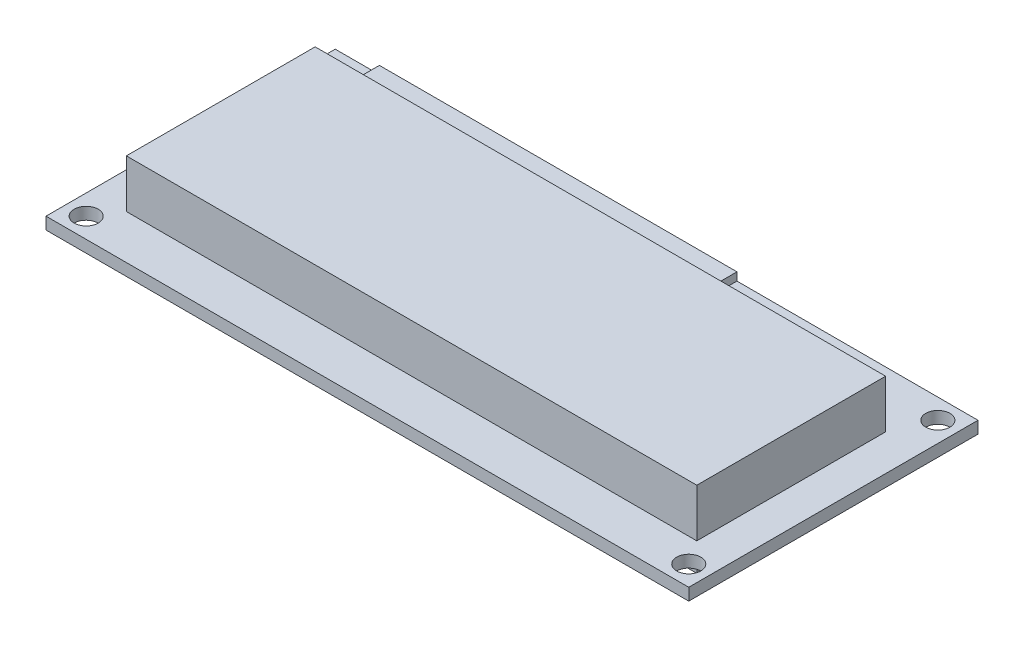
from build123d import *

# Parameters (mm, degrees)
SKETCH_1_W            = 80
SKETCH_1_H            = 36
SKETCH_1_R            = 1.5
EXTRUDE_1_DEPTH       = 1.5
EXTRUDE_START         = 7
EXTRUDE_2_OUTLINE_W   = 71
EXTRUDE_2_OUTLINE_H   = 6
EXTRUDE_2_OUTLINE_H_2 = 2
EXTRUDE_2_DEPTH       = 23.5
EXTRUDE_2_2_OUTLINE_W = 44.5
EXTRUDE_2_2_OUTLINE_H = 1
EXTRUDE_2_2_DEPTH     = 3.5


# Read off the part's stored shape, not the designer's step: Бобышка-Вытянуть2
with BuildPart() as part:
    # Эскиз1 (on Top Plane) → Бобышка-Вытянуть1 (new body)
    with BuildSketch(Plane(origin=(0, 0, 0), x_dir=(1, 0, 0), z_dir=(0, 1, 0))):
        with Locations((40, -18)):
            Rectangle(SKETCH_1_W, SKETCH_1_H)
        with Locations(Location((2.5, -2.5, 0), (0, 0, 270))):
            Circle(SKETCH_1_R, mode=Mode.SUBTRACT)
        with Locations(Location((77.5, -2.5, 0), (0, 0, 90))):
            Circle(SKETCH_1_R, mode=Mode.SUBTRACT)
        with Locations(Location((77.5, -33.5, 0), (0, 0, 270))):
            Circle(SKETCH_1_R, mode=Mode.SUBTRACT)
        with Locations(Location((2.5, -33.5, 0), (0, 0, 90))):
            Circle(SKETCH_1_R, mode=Mode.SUBTRACT)
    extrude(amount=EXTRUDE_1_DEPTH)

    # Бобышка-Вытянуть2 outline → Бобышка-Вытянуть2 (add)
    with BuildSketch(Plane.XY.offset(EXTRUDE_START)):
        with Locations((40, 4.5)):
            Rectangle(EXTRUDE_2_OUTLINE_W, EXTRUDE_2_OUTLINE_H)
        with Locations((40, -1)):
            Rectangle(EXTRUDE_2_OUTLINE_W, EXTRUDE_2_OUTLINE_H_2)
    extrude(amount=EXTRUDE_2_DEPTH)

    # Extrude 2 2 outline → Extrude 2 2 (add)
    with BuildSketch(Plane.XY):
        with Locations((27.75, 2)):
            Rectangle(EXTRUDE_2_2_OUTLINE_W, EXTRUDE_2_2_OUTLINE_H)
    extrude(amount=EXTRUDE_2_2_DEPTH)


solid = part.part
